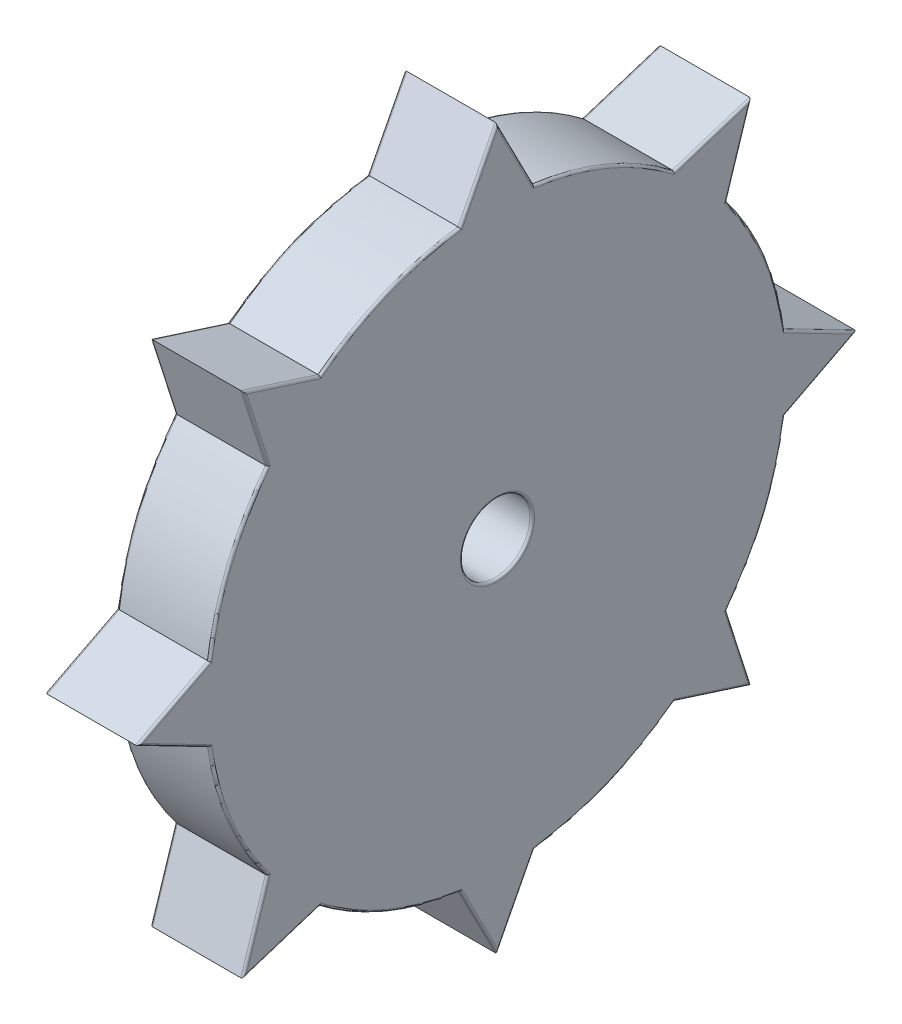
from build123d import *

# Parameters (mm, degrees)
SKETCH1_R           = 125
BOSS_EXTRUDE1_DEPTH = 40
BOSS_EXTRUDE3_START = -40
BOSS_EXTRUDE3_DEPTH = 40
SKETCH3_R           = 15
CUT_EXTRUDE1_DEPTH  = 40
FILLET1_R           = 1
FILLET3_R           = 1


# Read off the part's stored shape, not the designer's step: Boss-Extrude3
with BuildPart() as part:
    # Sketch1 → Boss-Extrude1 (new body)
    with BuildSketch(Plane(origin=(0, 0, 0), x_dir=(0, 0, -1), z_dir=(1, 0, 0))):
        Circle(SKETCH1_R)
    extrude(amount=BOSS_EXTRUDE1_DEPTH)

    # Boss-Extrude3 outline → Boss-Extrude3 (add)
    with BuildSketch(Plane.ZY.offset(BOSS_EXTRUDE3_START)):
        with BuildLine():
            Line((16, 123.97177098), (0, 155))
            Line((0, 155), (-16, 123.97177098))
            ThreePointArc((-16, 123.97177098), (0, 125), (16, 123.97177098))
        make_face()
        with BuildLine():
            ThreePointArc((-98.974988435, 76.347571437), (-88.388347648, 88.388347648), (-76.347571437, 98.974988435))
            Line((-76.347571437, 98.974988435), (-109.601551084, 109.601551084))
            Line((-109.601551084, 109.601551084), (-98.974988435, 76.347571437))
        make_face()
        with BuildLine():
            Line((109.601551084, 109.601551084), (76.347571437, 98.974988435))
            ThreePointArc((76.347571437, 98.974988435), (88.388347648, 88.388347648), (98.974988435, 76.347571437))
            Line((98.974988435, 76.347571437), (109.601551084, 109.601551084))
        make_face()
        with BuildLine():
            ThreePointArc((-123.97177098, -16), (-125, 0), (-123.97177098, 16))
            Line((-123.97177098, 16), (-155, 0))
            Line((-155, 0), (-123.97177098, -16))
        make_face()
        with BuildLine():
            Line((155, 0), (123.97177098, 16))
            ThreePointArc((123.97177098, 16), (125, 0), (123.97177098, -16))
            Line((123.97177098, -16), (155, 0))
        make_face()
        with BuildLine():
            ThreePointArc((-76.347571437, -98.974988435), (-88.388347648, -88.388347648), (-98.974988435, -76.347571437))
            Line((-98.974988435, -76.347571437), (-109.601551084, -109.601551084))
            Line((-109.601551084, -109.601551084), (-76.347571437, -98.974988435))
        make_face()
        with BuildLine():
            Line((109.601551084, -109.601551084), (98.974988435, -76.347571437))
            ThreePointArc((98.974988435, -76.347571437), (88.388347648, -88.388347648), (76.347571437, -98.974988435))
            Line((76.347571437, -98.974988435), (109.601551084, -109.601551084))
        make_face()
        with BuildLine():
            ThreePointArc((16, -123.97177098), (0, -125), (-16, -123.97177098))
            Line((-16, -123.97177098), (0, -155))
            Line((0, -155), (16, -123.97177098))
        make_face()
    extrude(amount=BOSS_EXTRUDE3_DEPTH)

    # Sketch3 → Cut-Extrude1 (cut)
    with BuildSketch(Plane(origin=(40, 0, 0), x_dir=(0, 0, -1), z_dir=(1, 0, 0))):
        Circle(SKETCH3_R)
    extrude(amount=-CUT_EXTRUDE1_DEPTH, mode=Mode.SUBTRACT)

    # Fillet1
    fillet1_edges = [part.edges().sort_by_distance(p)[0] for p in [
        (40, 0, 15),
        (40, 115.484941564, 47.835429046),
        (40, 139.48588549, 8),
        (40, 139.48588549, -8),
        (40, 115.484941564, -47.835429046),
        (40, 8, -139.48588549),
        (40, -8, -139.48588549),
        (40, -47.835429046, -115.484941564),
        (40, -92.97456126, -104.288269759),
        (40, -104.288269759, -92.97456126),
        (40, -115.484941564, -47.835429046),
        (40, -139.48588549, -8),
        (40, -139.48588549, 8),
        (40, -115.484941564, 47.835429046),
        (40, -104.288269759, 92.97456126),
        (40, -92.97456126, 104.288269759),
        (40, -47.835429046, 115.484941564),
        (40, -8, 139.48588549),
        (40, 8, 139.48588549),
        (40, 47.835429046, 115.484941564),
        (40, 92.97456126, 104.288269759),
        (40, 104.288269759, 92.97456126),
        (40, 104.288269759, -92.97456126),
        (40, 92.97456126, -104.288269759),
        (40, 47.835429046, -115.484941564),
    ]]
    fillet(fillet1_edges, radius=FILLET1_R)

    # Fillet3
    fillet3_edges = [part.edges().sort_by_distance(p)[0] for p in [
        (0, -139.48588549, 8),
        (0, -139.48588549, -8),
        (0, -47.835429046, -115.484941564),
        (0, -104.288269759, -92.97456126),
        (0, -92.97456126, -104.288269759),
        (0, 139.48588549, -8),
        (0, 47.835429046, -115.484941564),
        (0, 139.48588549, 8),
        (0, 8, -139.48588549),
        (0, -8, -139.48588549),
        (0, 115.484941564, -47.835429046),
        (0, 92.97456126, -104.288269759),
        (0, 104.288269759, -92.97456126),
        (0, 0, 15),
        (0, 47.835429046, 115.484941564),
        (0, 104.288269759, 92.97456126),
        (0, 92.97456126, 104.288269759),
        (0, -47.835429046, 115.484941564),
        (0, 115.484941564, 47.835429046),
        (0, 8, 139.48588549),
        (0, -8, 139.48588549),
        (0, -115.484941564, 47.835429046),
        (0, -92.97456126, 104.288269759),
        (0, -104.288269759, 92.97456126),
        (0, -115.484941564, -47.835429046),
    ]]
    fillet(fillet3_edges, radius=FILLET3_R)


solid = part.part
